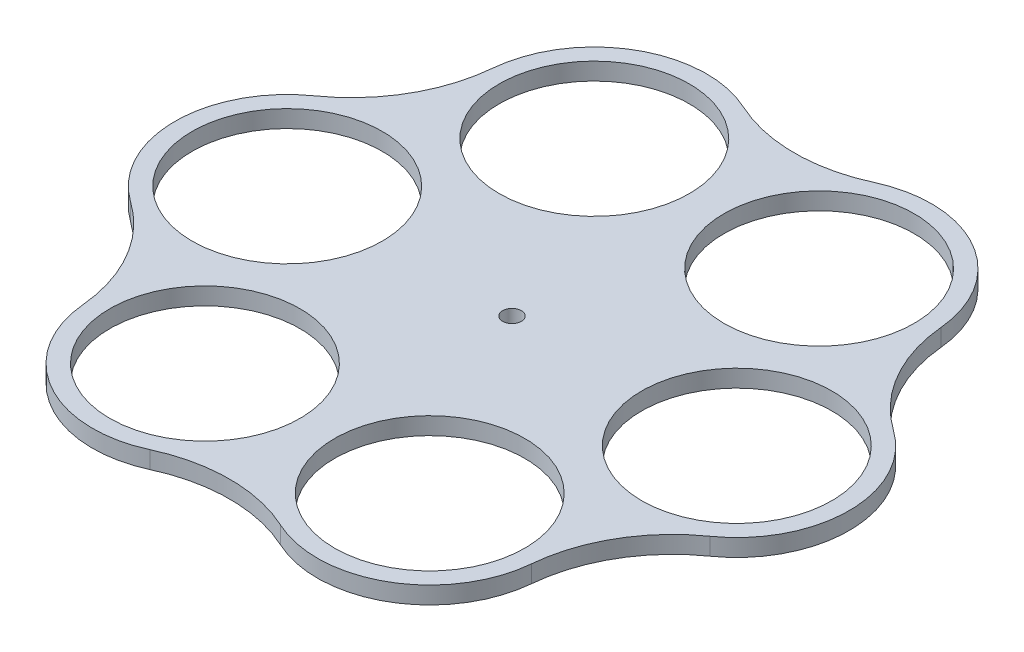
from build123d import *

# Parameters (mm, degrees)
SKETCH1_R           = 27.5
SKETCH1_R_2         = 2.7
BOSS_EXTRUDE1_DEPTH = 5


with BuildPart() as part:
    # Sketch1 → Boss-Extrude1 (new body)
    with BuildSketch(Plane(origin=(0, 0, 0), x_dir=(1, 0, 0), z_dir=(0, 1, 0))):
        with BuildLine():
            ThreePointArc((-73.745057262, -50.510666318), (-57.629130021, -75.707466022), (-27.750097763, -77.065868566))
            ThreePointArc((-27.750097763, -77.065868566), (-8.879130021, -72.917876797), (9.991837721, -77.065868566))
            ThreePointArc((9.991837721, -77.065868566), (39.870869979, -75.707466022), (55.986797219, -50.510666318))
            ThreePointArc((55.986797219, -50.510666318), (61.830014843, -32.093932975), (74.857764961, -17.825191401))
            ThreePointArc((74.857764961, -17.825191401), (88.620869979, 8.730010847), (74.857764961, 35.285213094))
            ThreePointArc((74.857764961, 35.285213094), (61.830014843, 49.553954668), (55.986797219, 67.970688011))
            ThreePointArc((55.986797219, 67.970688011), (39.870869979, 93.167487716), (9.991837721, 94.525890259))
            ThreePointArc((9.991837721, 94.525890259), (-8.879130021, 90.37789849), (-27.750097763, 94.525890259))
            ThreePointArc((-27.750097763, 94.525890259), (-57.629130021, 93.167487716), (-73.745057262, 67.970688011))
            ThreePointArc((-73.745057262, 67.970688011), (-79.588274886, 49.553954668), (-92.616025004, 35.285213094))
            ThreePointArc((-92.616025004, 35.285213094), (-106.379130021, 8.730010847), (-92.616025004, -17.825191401))
            ThreePointArc((-92.616025004, -17.825191401), (-79.588274886, -32.093932975), (-73.745057262, -50.510666318))
        make_face()
        with Locations((-41.379130021, 65.021662093)):
            Circle(SKETCH1_R, mode=Mode.SUBTRACT)
        with Locations((-73.879130021, 8.730010847)):
            Circle(SKETCH1_R, mode=Mode.SUBTRACT)
        with Locations((-41.379130021, -47.561640399)):
            Circle(SKETCH1_R, mode=Mode.SUBTRACT)
        with Locations((23.620869979, -47.561640399)):
            Circle(SKETCH1_R, mode=Mode.SUBTRACT)
        with Locations((56.120869979, 8.730010847)):
            Circle(SKETCH1_R, mode=Mode.SUBTRACT)
        with Locations((23.620869979, 65.021662093)):
            Circle(SKETCH1_R, mode=Mode.SUBTRACT)
        with Locations((-8.879130021, 8.730010847)):
            Circle(SKETCH1_R_2, mode=Mode.SUBTRACT)
    extrude(amount=BOSS_EXTRUDE1_DEPTH)


solid = part.part
